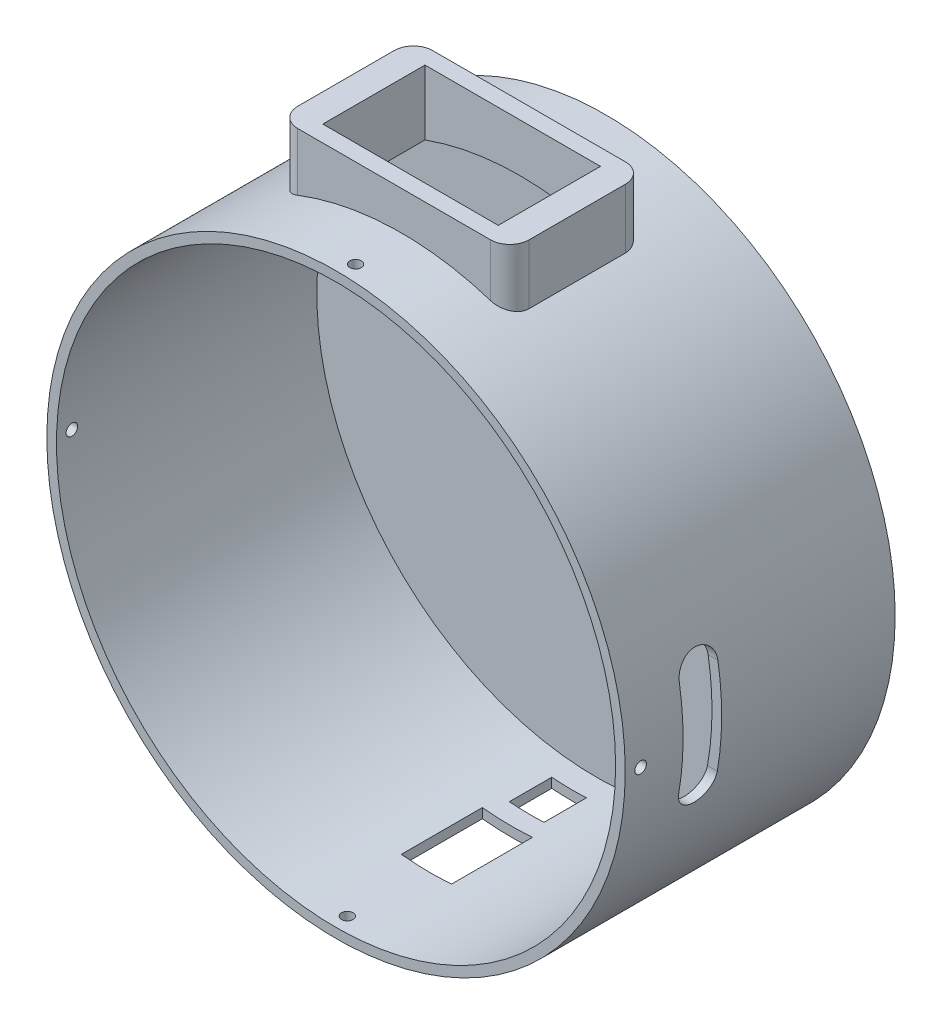
from build123d import *

# Parameters (mm, degrees)
SZKIC1_R                    = 75
DODANIE_WYCI_GNI_CIE1_DEPTH = 70
SKORUPA1_T                  = -2.5
SZKIC3_W                    = 13
SZKIC3_H                    = 21
WYTNIJ_WYCI_GNI_CIE1_DEPTH  = 60
SZKIC4_W                    = 9
SZKIC4_H                    = 11
WYTNIJ_WYCI_GNI_CIE2_DEPTH  = 60
SZKIC5_R                    = 1.5
WYTNIJ_WYCI_GNI_CIE3_DEPTH  = 60
SZYK_KO_OWY1_COUNT          = 4
DODANIE_WYCI_GNI_CIE2_REACH = 192.066
SZKIC7_W                    = 60
SZKIC7_H                    = 35
SZKIC8_W                    = 45.5
SZKIC8_H                    = 26.5
WYTNIJ_WYCI_GNI_CIE4_DEPTH  = 30
ZAOKR_GLENIE1_R             = 5
WYTNIJ_WYCI_GNI_CIE5_DEPTH  = 14


with BuildPart() as part:
    # Szkic1 → Dodanie-wyciągnięcie1 (new body)
    with BuildSketch(Plane.XY):
        Circle(SZKIC1_R)
    extrude(amount=DODANIE_WYCI_GNI_CIE1_DEPTH)

    # Skorupa1
    skorupa1_openings = [part.faces().sort_by_distance(p)[0] for p in [
        (0, 0, 70),
    ]]
    offset(amount=SKORUPA1_T, openings=skorupa1_openings, kind=Kind.INTERSECTION)

    # Szkic3 → Wytnij-wyciągnięcie1 (cut)
    with BuildSketch(Plane(origin=(0, -75, 0), x_dir=(-1, 0, 0), z_dir=(0, -1, 0))):
        with Locations((1.061442615, -35)):
            Rectangle(SZKIC3_W, SZKIC3_H)
    extrude(amount=-WYTNIJ_WYCI_GNI_CIE1_DEPTH, mode=Mode.SUBTRACT)

    # Szkic4 → Wytnij-wyciągnięcie2 (cut)
    with BuildSketch(Plane(origin=(0, -75, 0), x_dir=(-1, 0, 0), z_dir=(0, -1, 0))):
        with Locations((1.061442615, -14)):
            Rectangle(SZKIC4_W, SZKIC4_H)
    extrude(amount=-WYTNIJ_WYCI_GNI_CIE2_DEPTH, mode=Mode.SUBTRACT)

    # Szkic5 → Wytnij-wyciągnięcie3 (cut)
    with BuildSketch(Plane(origin=(0, -75, 0), x_dir=(-1, 0, 0), z_dir=(0, -1, 0))):
        with Locations((1.061442615, -66)):
            Circle(SZKIC5_R)
    wytnij_wyci_gni_cie3 = extrude(amount=-WYTNIJ_WYCI_GNI_CIE3_DEPTH, mode=Mode.SUBTRACT)

    # Szyk kołowy1: Wytnij-wyciągnięcie3 ×4 about axis
    szyk_ko_owy1_axis = Axis((0, 0, 70), (0, 0, 1))
    for i in range(1, SZYK_KO_OWY1_COUNT):
        add(wytnij_wyci_gni_cie3.rotate(szyk_ko_owy1_axis, i * 360 / SZYK_KO_OWY1_COUNT), mode=Mode.SUBTRACT)

    # Szkic7 → Dodanie-wyciągnięcie2 (add, up to next)
    with BuildSketch(Plane(origin=(0, 85, 0), x_dir=(-1, 0, 0), z_dir=(0, -1, 0)), mode=Mode.PRIVATE) as dodanie_wyci_gni_cie2_sk1:
        with Locations((1.900639924, -35.532003496)):
            Rectangle(SZKIC7_W, SZKIC7_H)
    dodanie_wyci_gni_cie2_tool1 = extrude(dodanie_wyci_gni_cie2_sk1.sketch, amount=DODANIE_WYCI_GNI_CIE2_REACH, mode=Mode.PRIVATE) - part.part
    add(dodanie_wyci_gni_cie2_tool1.solids().sort_by_distance((-1.90064, 85, 35.532003))[0])

    # Szkic8 → Wytnij-wyciągnięcie4 (cut)
    with BuildSketch(Plane(origin=(0, 85, 0), x_dir=(1, 0, 0), z_dir=(0, 1, 0))):
        with Locations((-1.900639924, -35.532003496)):
            Rectangle(SZKIC8_W, SZKIC8_H)
    extrude(amount=-WYTNIJ_WYCI_GNI_CIE4_DEPTH, mode=Mode.SUBTRACT)

    # Zaokrąglenie1
    zaokr_glenie1_edges = [part.edges().sort_by_distance(p)[0] for p in [
        (28.099360076, 77.268613588, 53.032003496),
        (28.099360076, 77.268613588, 18.032003496),
        (-31.900639924, 76.438728514, 53.032003496),
        (-31.900639924, 76.438728514, 18.032003496),
    ]]
    fillet(zaokr_glenie1_edges, radius=ZAOKR_GLENIE1_R)

    # Szkic9 → Wytnij-wyciągnięcie5 (cut)
    with BuildSketch(Plane(origin=(75, 0, 0), x_dir=(0, 0, -1), z_dir=(1, 0, 0))):
        with BuildLine():
            Line((-55, -12.979686846), (-55, 12.020313154))
            ThreePointArc((-55, 12.020313154), (-50, 17.020313154), (-45, 12.020313154))
            Line((-45, 12.020313154), (-45, -12.979686846))
            ThreePointArc((-45, -12.979686846), (-50, -17.979686846), (-55, -12.979686846))
        make_face()
    extrude(amount=-WYTNIJ_WYCI_GNI_CIE5_DEPTH, mode=Mode.SUBTRACT)


solid = part.part
